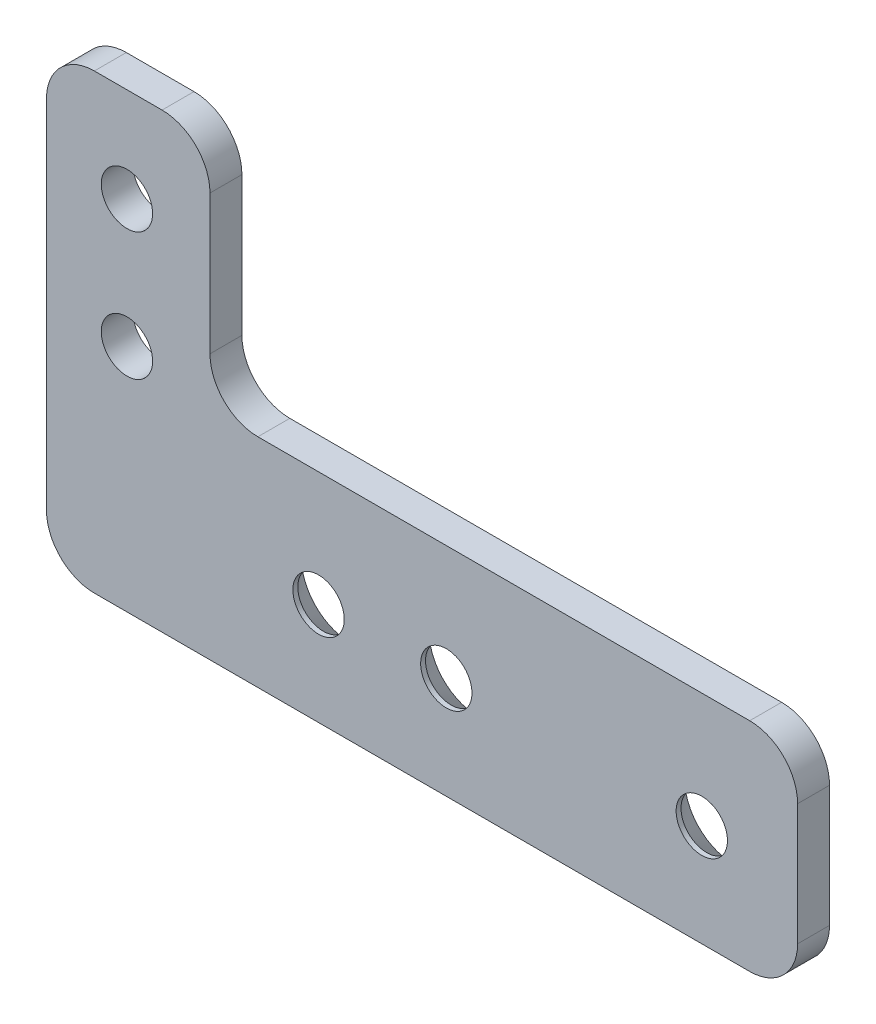
from build123d import *

# Parameters (mm, degrees)
SKETCH1_R                                    = 2.5527
BOSS_EXTRUDE1_DEPTH                          = 3.175
FILLET1_R                                    = 4.7625
CSK_FOR_10_FLAT_HEAD_MACHINE_SCREW3_AT_COUNT = 2
CSK_FOR_10_FLAT_HEAD_MACHINE_SCREW3_AT_PITCH = 25.4
CSK_FOR_10_FLAT_HEAD_MACHINE_SCREW3_2_COUNT  = 2
CSK_FOR_10_FLAT_HEAD_MACHINE_SCREW3_2_PITCH  = 38.1


with BuildPart() as part:
    # Sketch1 → Boss-Extrude1 (new body)
    with BuildSketch(Plane.XY):
        Polygon((-33.401, 23.749), (-33.401, -21.209), (41.275, -21.209), (41.275, 0.381), (-17.145, 0.381), (-17.145, 23.749), align=None)
        with Locations((-25.4, 1.651)):
            Circle(SKETCH1_R, mode=Mode.SUBTRACT)
        with Locations((-25.4, 14.351)):
            Circle(SKETCH1_R, mode=Mode.SUBTRACT)
    extrude(amount=BOSS_EXTRUDE1_DEPTH)

    # Fillet1
    fillet1_edges = [part.edges().sort_by_distance(p)[0] for p in [
        (-33.401, 23.749, 1.5875),
        (-17.145, 23.749, 1.5875),
        (-17.145, 0.381, 1.5875),
        (41.275, 0.381, 1.5875),
        (41.275, -21.209, 1.5875),
        (-33.401, -21.209, 1.5875),
    ]]
    fillet(fillet1_edges, radius=FILLET1_R)

    # Sketch7 → CSK for #10 Flat Head Machine Screw3 (revolve, cut)
    with BuildSketch(Plane(origin=(31.75, -11.049, 0), x_dir=(0, 1, 0), z_dir=(1, 0, 0))):
        Polygon((0, 0), (0, 3.175), (2.5527, 3.175), (2.5527, 2.688180894), (4.8895, 0), align=None)
    csk_for_10_flat_head_machine_screw3 = revolve(axis=Axis((31.75, -11.049, -6.35), (0, 0, 1)), mode=Mode.SUBTRACT)

    # CSK for #10 Flat Head Machine Screw3 at: CSK for #10 Flat Head Machine Screw3 ×2
    with Locations(*[(-i * CSK_FOR_10_FLAT_HEAD_MACHINE_SCREW3_AT_PITCH, 0, 0) for i in range(1, CSK_FOR_10_FLAT_HEAD_MACHINE_SCREW3_AT_COUNT)]):
        add(csk_for_10_flat_head_machine_screw3, mode=Mode.SUBTRACT)

    # CSK for _10 Flat Head Machine Screw3 2: CSK for #10 Flat Head Machine Screw3 ×2
    with Locations(*[(-i * CSK_FOR_10_FLAT_HEAD_MACHINE_SCREW3_2_PITCH, 0, 0) for i in range(1, CSK_FOR_10_FLAT_HEAD_MACHINE_SCREW3_2_COUNT)]):
        add(csk_for_10_flat_head_machine_screw3, mode=Mode.SUBTRACT)


solid = part.part
